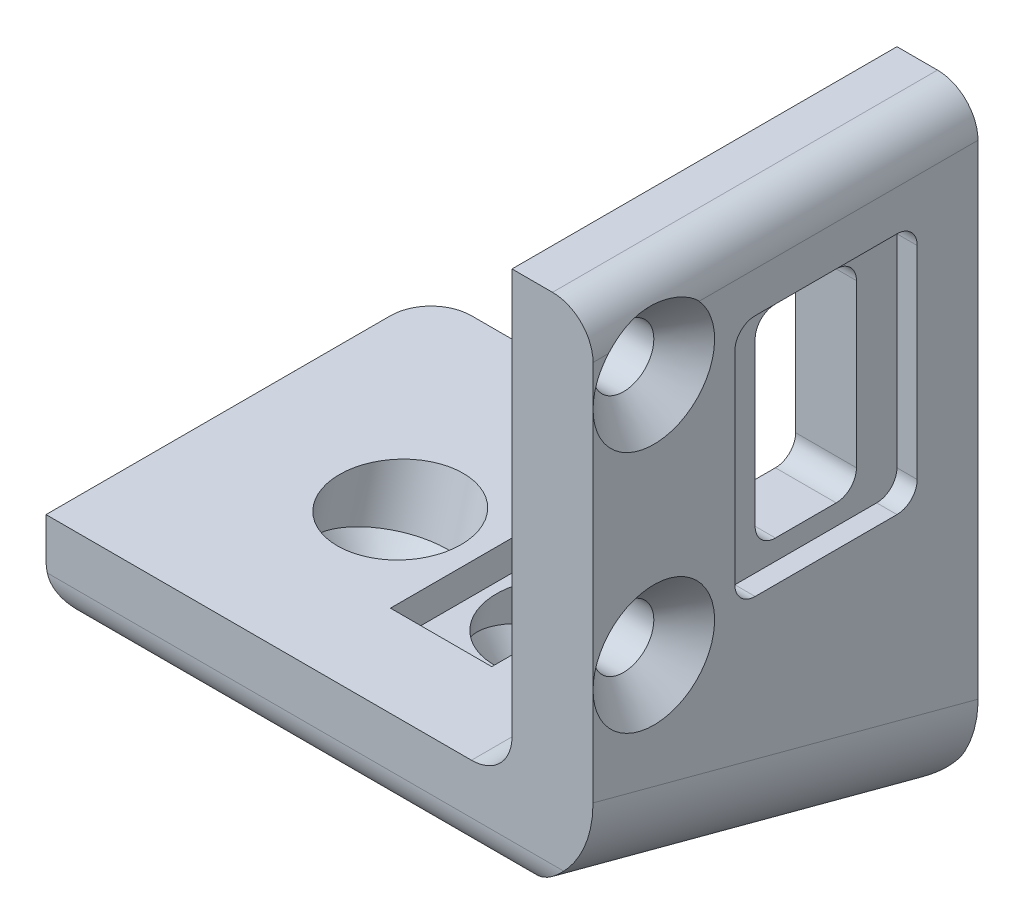
from build123d import *

# Parameters (mm, degrees)
SKETCH_1_W                = 27
SKETCH_1_H                = 15
EXTRUDE_1_DEPTH           = 8
CUT_EXTRUDE_8_DEPTH       = 41.5
SKETCH_5_W                = 4
SKETCH_5_H                = 15
EXTRUDE_3_DEPTH           = 24
SKETCH_7_W                = 5
SKETCH_7_H                = 6.5
CUT_EXTRUDE_5_DEPTH       = 1.5
SKETCH_10_R               = 1.5
CUT_EXTRUDE_6_DEPTH       = 21.5
SKETCH_12_W               = 5
SKETCH_12_H               = 10
CUT_EXTRUDE_7_DEPTH       = 21.5
SKETCH_14_W               = 4
SKETCH_14_H               = 2
CUT_EXTRUDE_9_DEPTH       = 21.5
SKETCH_15_R               = 1.5
CUT_EXTRUDE_10_DEPTH      = 21.5
EXTRUDE_6_DEPTH           = 4
CUT_EXTRUDE_13_DEPTH      = 1.5
CUT_EXTRUDE_13_DEPTH_BACK = 12
SKETCH_17_R               = 3
CUT_EXTRUDE_15_DEPTH      = 1
CUT_EXTRUDE_15_DEPTH_BACK = 2.5
SKETCH_19_R               = 3
CUT_EXTRUDE_16_DEPTH      = 54
SKETCH_23_W               = 9
SKETCH_23_H               = 12
CUT_EXTRUDE_17_DEPTH      = 1
FILLET_2_R                = 2
FILLET_3_R                = 2
FILLET_4_R                = 5
CHAMFER_1_SIZE            = 1.5
FILLET_5_R                = 2
FILLET_8_R                = 1


with BuildPart() as part:
    # 草图1 → 凸台-拉伸1 (new body)
    with BuildSketch(Plane(origin=(0, 0, 0), x_dir=(1, 0, 0), z_dir=(0, 1, 0))):
        Rectangle(SKETCH_1_W, SKETCH_1_H)
    extrude(amount=EXTRUDE_1_DEPTH)

    # 草图13 → 切除-拉伸8 (cut)
    with BuildSketch(Plane(origin=(13.5, 0, 0), x_dir=(0, 0, -1), z_dir=(1, 0, 0))):
        Polygon((-7.5, 4), (7.5, 0), (-7.5, 0), align=None)
    extrude(amount=-CUT_EXTRUDE_8_DEPTH, mode=Mode.SUBTRACT)

    # 草图5 → 凸台-拉伸3 (add)
    with BuildSketch(Plane(origin=(0, 8, 0), x_dir=(1, 0, 0), z_dir=(0, 1, 0))):
        with Locations((11.5, 0)):
            Rectangle(SKETCH_5_W, SKETCH_5_H)
    extrude(amount=EXTRUDE_3_DEPTH)

    # 草图7 → 切除-拉伸5 (cut)
    with BuildSketch(Plane(origin=(0, 8, 0), x_dir=(1, 0, 0), z_dir=(0, 1, 0))):
        with Locations((1.5, 0.25)):
            Rectangle(SKETCH_7_W, SKETCH_7_H)
    extrude(amount=-CUT_EXTRUDE_5_DEPTH, mode=Mode.SUBTRACT)

    # 草图10 → 切除-拉伸6 (cut)
    with BuildSketch(Plane.ZY.offset(-13.5)):
        with Locations(Location((4.5, 14, 0), (0, 0, 180))):
            Circle(SKETCH_10_R)
        with Locations(Location((4.5, 26, 0), (0, 0, 180))):
            Circle(SKETCH_10_R)
    extrude(amount=CUT_EXTRUDE_6_DEPTH, mode=Mode.SUBTRACT)

    # 草图12 → 切除-拉伸7 (cut)
    with BuildSketch(Plane.ZY.offset(-9.5)):
        with Locations((-4, 20)):
            Rectangle(SKETCH_12_W, SKETCH_12_H)
    extrude(amount=-CUT_EXTRUDE_7_DEPTH, mode=Mode.SUBTRACT)

    # 草图14 → 切除-拉伸9 (cut)
    with BuildSketch(Plane.XY.offset(7.5)):
        with Locations((11.5, 31)):
            Rectangle(SKETCH_14_W, SKETCH_14_H)
    extrude(amount=-CUT_EXTRUDE_9_DEPTH, mode=Mode.SUBTRACT)

    # 草图15 → 切除-拉伸10 (cut)
    with BuildSketch(Plane(origin=(0, 1.867219917, -0.497925311), x_dir=(1, 0, 0), z_dir=(0, -0.9662349396012463, 0.25766265056033233))):
        with Locations(Location((-4.971460236, 0.653668071, 0), (0, 0, 270))):
            Circle(SKETCH_15_R)
        with Locations(Location((2.5, 0, 0), (0, 0, 270))):
            Circle(SKETCH_15_R)
    extrude(amount=-CUT_EXTRUDE_10_DEPTH, mode=Mode.SUBTRACT)

    # 草图21 → 凸台-拉伸6 (add)
    with BuildSketch(Plane(origin=(0, 0, -7.5), x_dir=(-1, 0, 0), z_dir=(0, 0, -1))):
        Polygon((-13.5, -1.987071707), (11.82839978, -1.987071707), (13.5, -1.987071707), (13.5, 8), (-9.5, 8), (-9.5, 30), (-13.5, 30), (-13.5, 8), align=None)
    extrude(amount=EXTRUDE_6_DEPTH)

    # 草图17 → 切除-拉伸13 (cut, two sides: drawn at the far end of the back side and taken through both)
    with BuildSketch(Plane(origin=(0, 6.698394615, -1.786238564), x_dir=(-1, 0, 0), z_dir=(0, -0.9662349396012463, 0.25766265056033233)).offset(-CUT_EXTRUDE_13_DEPTH_BACK)):
        with Locations(Location((-2.5, 0, 0), (0, 0, 240))):
            Circle(SKETCH_17_R)
    extrude(amount=CUT_EXTRUDE_13_DEPTH + CUT_EXTRUDE_13_DEPTH_BACK, mode=Mode.SUBTRACT)

    # 草图19 → 切除-拉伸15 (cut, two sides: drawn at the far end of the back side and taken through both)
    with BuildSketch(Plane(origin=(0, 6.698394615, -1.786238564), x_dir=(-1, 0, 0), z_dir=(0, -0.9662349396012463, 0.25766265056033233)).offset(-CUT_EXTRUDE_15_DEPTH_BACK)):
        with Locations(Location((4.971460236, -0.653668071, 0), (0, 0, 90))):
            Circle(SKETCH_19_R)
    extrude(amount=CUT_EXTRUDE_15_DEPTH + CUT_EXTRUDE_15_DEPTH_BACK, mode=Mode.SUBTRACT)

    # 草图22 → 切除-拉伸16 (cut)
    with BuildSketch(Plane(origin=(13.5, 0, 0), x_dir=(0, 0, -1), z_dir=(1, 0, 0))):
        Polygon((-7.5, 4), (7.5, 0), (11.5, -1.066666667), (11.5, -3.267506917), (3.736378374, -2.578943079), align=None)
    extrude(amount=-CUT_EXTRUDE_16_DEPTH, mode=Mode.SUBTRACT)

    # 草图23 → 切除-拉伸17 (cut)
    with BuildSketch(Plane.ZY.offset(-13.5)):
        with Locations((-4, 20)):
            Rectangle(SKETCH_23_W, SKETCH_23_H)
    extrude(amount=CUT_EXTRUDE_17_DEPTH, mode=Mode.SUBTRACT)

    # 圆角2
    fillet_2_edges = [part.edges().sort_by_distance(p)[0] for p in [
        (9.5, 8, -2),
    ]]
    fillet(fillet_2_edges, radius=FILLET_2_R)

    # 圆角3
    fillet_3_edges = [part.edges().sort_by_distance(p)[0] for p in [
        (13.5, 30, -2),
    ]]
    fillet(fillet_3_edges, radius=FILLET_3_R)

    # 圆角4
    fillet_4_edges = [part.edges().sort_by_distance(p)[0] for p in [
        (13.5, 1.466666667, -2),
    ]]
    fillet(fillet_4_edges, radius=FILLET_4_R)

    # 倒角1
    # the kernel refuses this chamfer: 1.5 mm, written as the material it takes off along each edge
    with BuildSketch(Plane(origin=(2.5, 5.249042206, -1.399744588), x_dir=(0, -0.2576626505603323, -0.9662349396012463), z_dir=(-1, 0, 0))) as chamfer_1_piece_1_section:
        Polygon((1.5, CHAMFER_1_SIZE), (1.5 + CHAMFER_1_SIZE, 0), (1.5, 0), align=None)
    chamfer_1_piece_1 = revolve(axis=Axis((2.5, 5.249042206, -1.399744588), (0, -0.9662349396012463, 0.25766265056033233)), mode=Mode.PRIVATE)
    chamfer_1_piece_1 = chamfer_1_piece_1 & Plane(origin=(2.5, 4.520895406, -1.205572108), x_dir=(0.5000000000000004, 0.22314240099168048, 0.8367840037188018), z_dir=(0, -0.9662349396012463, 0.25766265056033233)) * Cylinder(3, 12, mode=Mode.PRIVATE)
    add(chamfer_1_piece_1, mode=Mode.SUBTRACT)
    with BuildSketch(Plane(origin=(-4.971460236, 5.900585523, -0.896978985), x_dir=(0, -0.25766265056033244, -0.9662349396012462), z_dir=(-1, 0, 0))) as chamfer_1_piece_2_section:
        Polygon((1.5, CHAMFER_1_SIZE), (1.5 + CHAMFER_1_SIZE, 0), (1.5, 0), align=None)
    chamfer_1_piece_2 = revolve(axis=Axis((-4.971460236, 5.900585523, -0.896978985), (0, -0.9662349396012463, 0.25766265056033233)), mode=Mode.PRIVATE)
    chamfer_1_piece_2 = chamfer_1_piece_2 & Plane(origin=(-4.971460236, 5.172438723, -0.702806505), x_dir=(0, -0.25766265056033233, -0.9662349396012463), z_dir=(0, 0.9662349396012463, -0.25766265056033233)) * Cylinder(3, 13, mode=Mode.PRIVATE)
    add(chamfer_1_piece_2, mode=Mode.SUBTRACT)
    with BuildSketch(Plane(origin=(13.5, 14, 4.5), x_dir=(0, 0, -1), z_dir=(0, 1, 0))) as chamfer_1_piece_3:
        Polygon((1.5 + CHAMFER_1_SIZE, 0), (1.5, CHAMFER_1_SIZE), (1.5, 0), align=None)
    revolve(axis=Axis((13.5, 14, 4.5), (-1, 0, 0)), mode=Mode.SUBTRACT)
    with BuildSketch(Plane(origin=(13.5, 26, 4.5), x_dir=(0, 0, -1), z_dir=(0, 1, 0))) as chamfer_1_piece_4:
        Polygon((1.5 + CHAMFER_1_SIZE, 0), (1.5, CHAMFER_1_SIZE), (1.5, 0), align=None)
    revolve(axis=Axis((13.5, 26, 4.5), (-1, 0, 0)), mode=Mode.SUBTRACT)

    # 圆角5
    # the kernel refuses this fillet: 2 mm, written as the material it takes off along each edge
    with BuildSketch(Plane(origin=(-11.5, 1.536556626, -9.5), x_dir=(0, 0, -1), z_dir=(-1, 0, 0))) as fillet_5_piece_1_section:
        Polygon((0, 0), (FILLET_5_R * 1.02, 0), (FILLET_5_R * 1.02, FILLET_5_R * 1.32764387935), (-FILLET_5_R * 0.262815903572, FILLET_5_R * 0.985559638393), align=None)
    fillet_5_piece_1 = extrude(amount=FILLET_5_R * 1.02, mode=Mode.PRIVATE)
    fillet_5_piece_1 = fillet_5_piece_1 - Plane(origin=(-11.5, 1.536556626, -9.5), x_dir=(0, 0.7929888557099438, 0.6092361403592483), z_dir=(-1, 0, 0)) * Sphere(FILLET_5_R, mode=Mode.PRIVATE)
    add(fillet_5_piece_1, mode=Mode.SUBTRACT)
    with BuildSketch(Plane(origin=(-13.5, -0.395913253, -8.984674699), x_dir=(1, 0, 0), z_dir=(0, 0.2576626505603323, 0.9662349396012463))) as fillet_5_piece_2:
        with BuildLine():
            CenterArc((FILLET_5_R, FILLET_5_R), FILLET_5_R, 180, 90)
            Line((0, FILLET_5_R), (0, 0))
            Line((0, 0), (FILLET_5_R, 0))
        make_face()
    extrude(amount=22.060731322, mode=Mode.SUBTRACT)
    with BuildSketch(Plane(origin=(12.341391565, 4, 7.5), x_dir=(0, 1, 0), z_dir=(-1, 0, 0))) as fillet_5_piece_3:
        with BuildLine():
            CenterArc((FILLET_5_R * 0.768278313084, FILLET_5_R), FILLET_5_R, 194.931417178, 75.068582822)
            Line((-FILLET_5_R * 0.197956626517, FILLET_5_R * 0.74233734944), (0, 0))
            Line((0, 0), (FILLET_5_R * 0.768278313084, 0))
        make_face()
    extrude(amount=29.682783131, mode=Mode.SUBTRACT)
    with BuildSketch(Plane(origin=(15.008058232, -1.066666667, -11.5), x_dir=(0, 0.25766265056033255, 0.9662349396012463), z_dir=(-1, 0, 0))) as fillet_5_piece_4:
        with BuildLine():
            CenterArc((FILLET_5_R * 1.30161164642, FILLET_5_R), FILLET_5_R, 165.068582822, 104.931417178)
            Line((FILLET_5_R * 0.335376706816, FILLET_5_R * 1.25766265056), (0, 0))
            Line((0, 0), (FILLET_5_R * 1.30161164642, 0))
        make_face()
    extrude(amount=26.508058232, mode=Mode.SUBTRACT)
    with BuildSketch(Plane(origin=(-13.5, 1.536556626, -11.5), x_dir=(0, 0, 1), z_dir=(0, 1, 0))) as fillet_5_piece_5:
        with BuildLine():
            CenterArc((FILLET_5_R, FILLET_5_R), FILLET_5_R, 180, 90)
            Line((0, FILLET_5_R), (0, 0))
            Line((0, 0), (FILLET_5_R, 0))
        make_face()
    extrude(amount=11.463443374, mode=Mode.SUBTRACT)

    # 圆角8
    fillet_8_edges = [part.edges().sort_by_distance(p)[0] for p in [
        (11, 25, -1.5),
        (11, 25, -6.5),
        (11, 15, -6.5),
        (11, 15, -1.5),
        (13, 14, 0.5),
        (13, 26, 0.5),
        (13, 26, -8.5),
        (13, 14, -8.5),
    ]]
    fillet(fillet_8_edges, radius=FILLET_8_R)


solid = part.part
